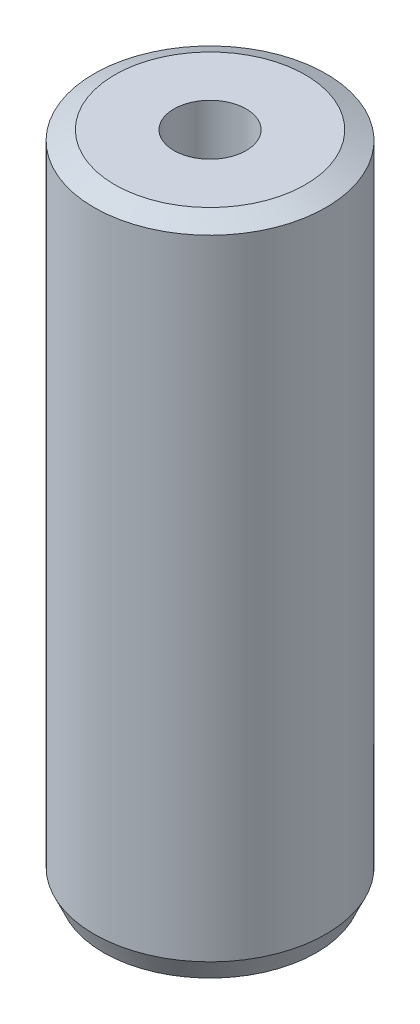
from build123d import *
from OCP.BRepFilletAPI import BRepFilletAPI_MakeChamfer

# Parameters (mm, degrees)
SKETCH1_R           = 47.5
BOSS_EXTRUDE1_DEPTH = 270.112423651
SKETCH2_R           = 14.795765636
CUT_EXTRUDE1_DEPTH  = 279.340118219
CHAMFER1_SIZE       = 3.853571474
CHAMFER1_SIZE2      = 8.475204011


with BuildPart() as part:
    # Sketch1 → Boss-Extrude1 (new body)
    with BuildSketch(Plane(origin=(0, 0, 0), x_dir=(1, 0, 0), z_dir=(0, 1, 0))):
        Circle(SKETCH1_R)
    extrude(amount=BOSS_EXTRUDE1_DEPTH)

    # Sketch2 → Cut-Extrude1 (cut, through all)
    with BuildSketch(Plane(origin=(0, 0, 0), x_dir=(1, 0, 0), z_dir=(0, 1, 0))):
        Circle(SKETCH2_R)
    extrude(amount=CUT_EXTRUDE1_DEPTH, mode=Mode.SUBTRACT)

    # Chamfer1: one chamfer whose edges measure the first distance from different faces: ONE call of the kernel's chamfer builder (chamfer() names one face for all edges)
    chamfer1_edges_1 = [part.edges().sort_by_distance(p)[0] for p in [
        (-47.5, 270.112423651, 0),
    ]]
    chamfer1_side_1 = [part.faces().sort_by_distance(p)[0] for p in [
        (-47.5, 135.056211825, 0),
    ]]
    chamfer1_edges_2 = [part.edges().sort_by_distance(p)[0] for p in [
        (-47.5, 0, 0),
    ]]
    chamfer1_side_2 = [part.faces().sort_by_distance(p)[0] for p in [
        (-46.156497116, 0, 0),
    ]]
    chamfer1 = BRepFilletAPI_MakeChamfer(part.part.solid().wrapped)
    for e in chamfer1_edges_1:
        chamfer1.Add(CHAMFER1_SIZE, CHAMFER1_SIZE2, e.wrapped, chamfer1_side_1[0].wrapped)  # the first distance lies on this face
    for e in chamfer1_edges_2:
        chamfer1.Add(CHAMFER1_SIZE, CHAMFER1_SIZE2, e.wrapped, chamfer1_side_2[0].wrapped)  # the first distance lies on this face
    add(Compound.cast(chamfer1.Shape()), mode=Mode.REPLACE)


solid = part.part
